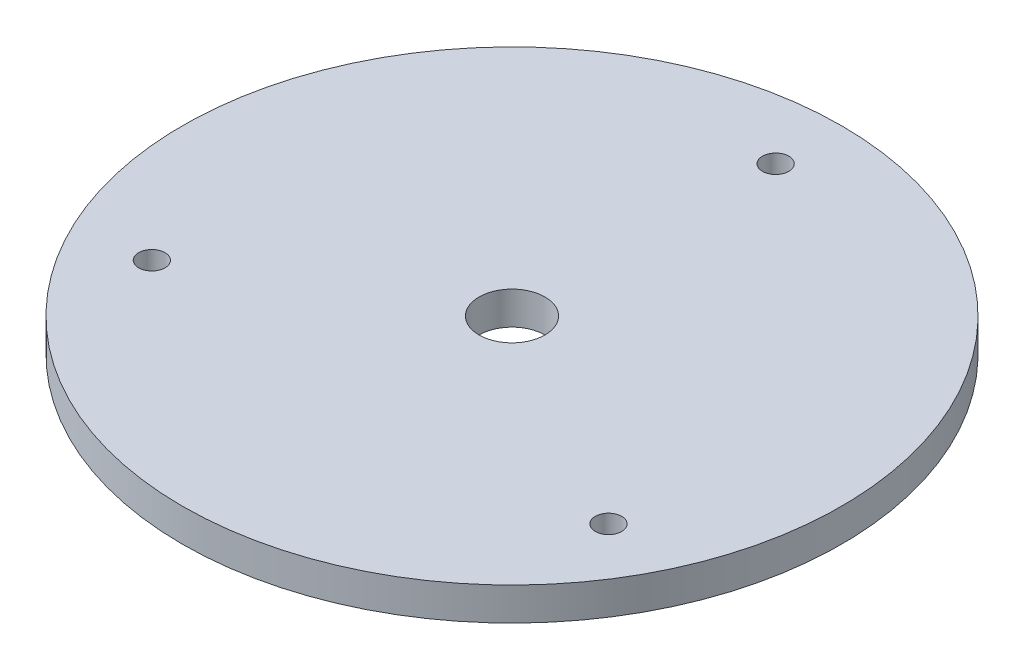
from build123d import *

# Parameters (mm, degrees)
CROQUIS1_R              = 100
CROQUIS1_R_2            = 10
CROQUIS1_R_3            = 4
SALIENTE_EXTRUIR1_DEPTH = 10


with BuildPart() as part:
    # Croquis1 → Saliente-Extruir1 (new body)
    with BuildSketch(Plane(origin=(0, 0, 0), x_dir=(1, 0, 0), z_dir=(0, 1, 0))):
        Circle(CROQUIS1_R)
        Circle(CROQUIS1_R_2, mode=Mode.SUBTRACT)
        with Locations((-69.282032303, -40)):
            Circle(CROQUIS1_R_3, mode=Mode.SUBTRACT)
        with Locations((69.282032303, -40)):
            Circle(CROQUIS1_R_3, mode=Mode.SUBTRACT)
        with Locations((0, 80)):
            Circle(CROQUIS1_R_3, mode=Mode.SUBTRACT)
    extrude(amount=SALIENTE_EXTRUIR1_DEPTH)


solid = part.part
